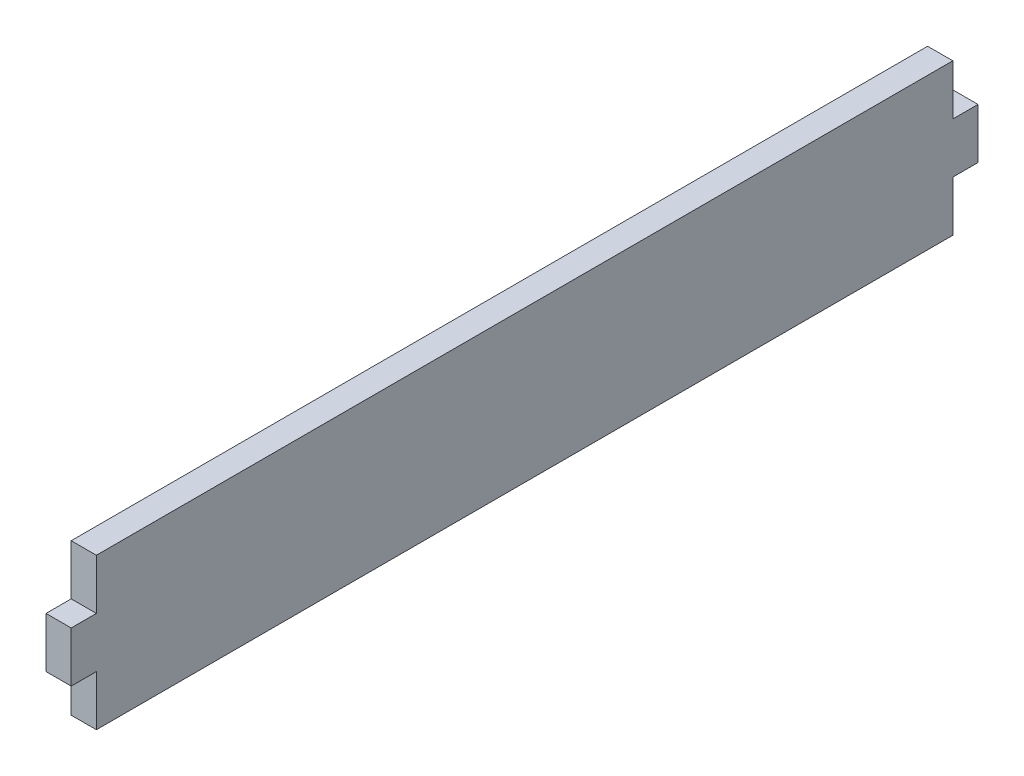
from build123d import *

# Parameters (mm, degrees)
BOSS_EXTRUDE1_DEPTH = 2.54


with BuildPart() as part:
    # Sketch1 → Boss-Extrude1 (new body)
    with BuildSketch(Plane(origin=(0, 0, 0), x_dir=(0, 0, -1), z_dir=(1, 0, 0))):
        Polygon((-43.18, 7.62), (-43.18, 2.54), (-45.72, 2.54), (-45.72, -2.54), (-43.18, -2.54), (-43.18, -7.62), (43.18, -7.62), (43.18, -2.54), (45.72, -2.54), (45.72, 2.54), (43.18, 2.54), (43.18, 7.62), align=None)
    extrude(amount=BOSS_EXTRUDE1_DEPTH)


solid = part.part
